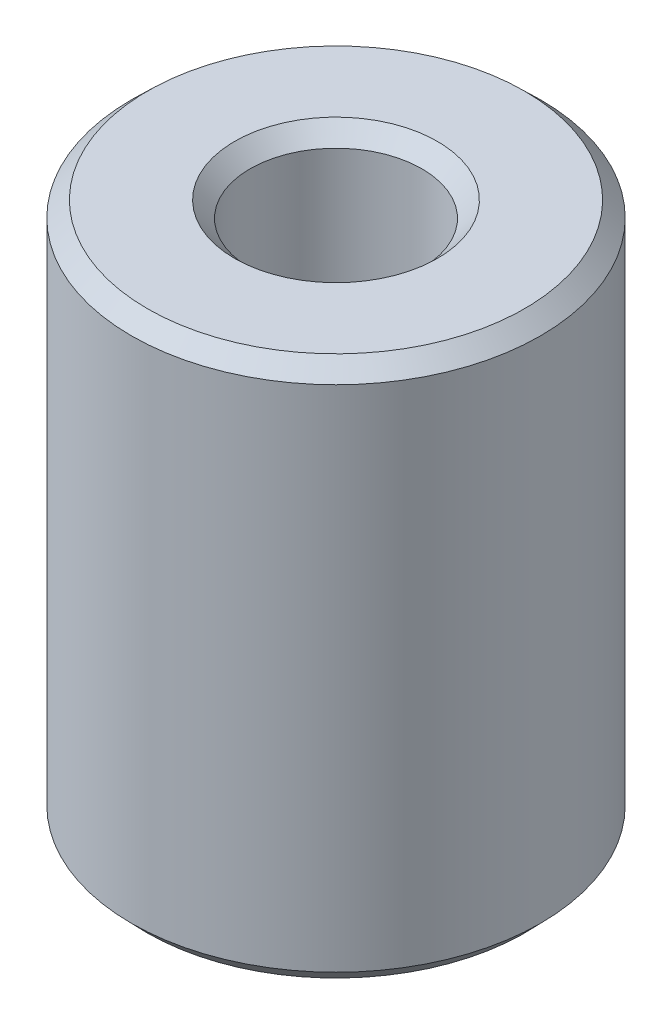
from build123d import *
from OCP.BRepFilletAPI import BRepFilletAPI_MakeChamfer

# Parameters (mm, degrees)
SKETCH1_R           = 20
BOSS_EXTRUDE1_DEPTH = 52.83301338
SKETCH2_R           = 8.404068988
CUT_EXTRUDE1_DEPTH  = 60.927683943
CHAMFER1_SIZE       = 1.514280229
CHAMFER1_SIZE2      = 1.562881969


with BuildPart() as part:
    # Sketch1 → Boss-Extrude1 (new body)
    with BuildSketch(Plane(origin=(0, 0, 0), x_dir=(1, 0, 0), z_dir=(0, 1, 0))):
        Circle(SKETCH1_R)
    extrude(amount=BOSS_EXTRUDE1_DEPTH)

    # Sketch2 → Cut-Extrude1 (cut, through all)
    with BuildSketch(Plane(origin=(0, 0, 0), x_dir=(1, 0, 0), z_dir=(0, 1, 0))):
        Circle(SKETCH2_R)
    extrude(amount=CUT_EXTRUDE1_DEPTH, mode=Mode.SUBTRACT)

    # Chamfer1: one chamfer whose edges measure the first distance from different faces: ONE call of the kernel's chamfer builder (chamfer() names one face for all edges)
    chamfer1_edges_1 = [part.edges().sort_by_distance(p)[0] for p in [
        (-8.404068988, 52.83301338, 0),
    ]]
    chamfer1_side_1 = [part.faces().sort_by_distance(p)[0] for p in [
        (-19.434314575, 52.83301338, 0),
    ]]
    chamfer1_edges_2 = [part.edges().sort_by_distance(p)[0] for p in [
        (-8.404068988, 0, 0),
    ]]
    chamfer1_side_2 = [part.faces().sort_by_distance(p)[0] for p in [
        (-8.404068988, 26.41650669, 0),
    ]]
    chamfer1_edges_3 = [part.edges().sort_by_distance(p)[0] for p in [
        (-20, 0, 0),
    ]]
    chamfer1_side_3 = [part.faces().sort_by_distance(p)[0] for p in [
        (-19.434314575, 0, 0),
    ]]
    chamfer1_edges_4 = [part.edges().sort_by_distance(p)[0] for p in [
        (-20, 52.83301338, 0),
    ]]
    chamfer1_side_4 = [part.faces().sort_by_distance(p)[0] for p in [
        (-20, 26.41650669, 0),
    ]]
    chamfer1 = BRepFilletAPI_MakeChamfer(part.part.solid().wrapped)
    for e in chamfer1_edges_1:
        chamfer1.Add(CHAMFER1_SIZE, CHAMFER1_SIZE2, e.wrapped, chamfer1_side_1[0].wrapped)  # the first distance lies on this face
    for e in chamfer1_edges_2:
        chamfer1.Add(CHAMFER1_SIZE, CHAMFER1_SIZE2, e.wrapped, chamfer1_side_2[0].wrapped)  # the first distance lies on this face
    for e in chamfer1_edges_3:
        chamfer1.Add(CHAMFER1_SIZE, CHAMFER1_SIZE2, e.wrapped, chamfer1_side_3[0].wrapped)  # the first distance lies on this face
    for e in chamfer1_edges_4:
        chamfer1.Add(CHAMFER1_SIZE, CHAMFER1_SIZE2, e.wrapped, chamfer1_side_4[0].wrapped)  # the first distance lies on this face
    add(Compound.cast(chamfer1.Shape()), mode=Mode.REPLACE)


solid = part.part
